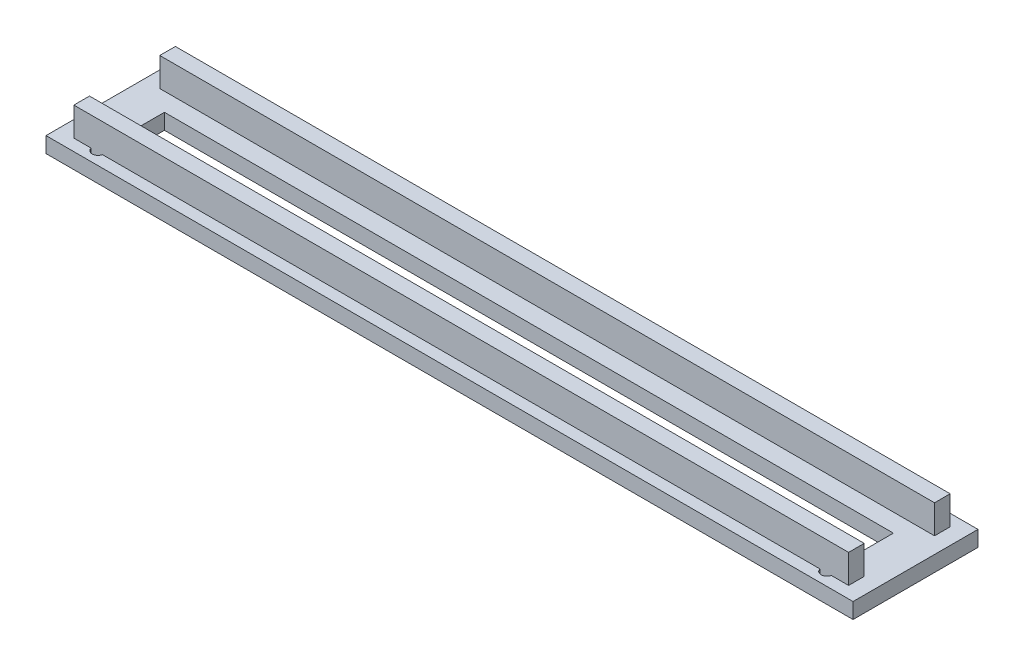
from build123d import *

# Parameters (mm, degrees)
F_01_RAIL_BASE_PROFILE_W   = 620
F_01_RAIL_BASE_PROFILE_H   = 96
F_01_RAIL_BASE_PROFILE_R   = 4.5
F_01_RAIL_BASE_PROFILE_W_2 = 560
F_01_RAIL_BASE_PROFILE_H_2 = 26
F_01_RAIL_BASE_DEPTH       = 12
F_02_GUIDE_RAIL_PROFILES_W = 595.2
F_02_GUIDE_RAIL_PROFILES_H = 12
F_02_GUIDE_RAILS_DEPTH     = 34


with BuildPart() as part:
    # 01_Rail_Base_Profile → 01_Rail_Base (new body)
    with BuildSketch(Plane(origin=(0, 0, 0), x_dir=(1, 0, 0), z_dir=(0, 1, 0))):
        Rectangle(F_01_RAIL_BASE_PROFILE_W, F_01_RAIL_BASE_PROFILE_H)
        with Locations((-280, -38)):
            Circle(F_01_RAIL_BASE_PROFILE_R, mode=Mode.SUBTRACT)
        with Locations((-280, 38)):
            Circle(F_01_RAIL_BASE_PROFILE_R, mode=Mode.SUBTRACT)
        with Locations((280, -38)):
            Circle(F_01_RAIL_BASE_PROFILE_R, mode=Mode.SUBTRACT)
        with Locations((280, 38)):
            Circle(F_01_RAIL_BASE_PROFILE_R, mode=Mode.SUBTRACT)
        Rectangle(F_01_RAIL_BASE_PROFILE_W_2, F_01_RAIL_BASE_PROFILE_H_2, mode=Mode.SUBTRACT)
    extrude(amount=F_01_RAIL_BASE_DEPTH)

    # 02_Guide_Rail_Profiles → 02_Guide_Rails (add)
    with BuildSketch(Plane(origin=(0, 0, 0), x_dir=(1, 0, 0), z_dir=(0, 1, 0))):
        with Locations((0, 33)):
            Rectangle(F_02_GUIDE_RAIL_PROFILES_W, F_02_GUIDE_RAIL_PROFILES_H)
        with Locations((0, -33)):
            Rectangle(F_02_GUIDE_RAIL_PROFILES_W, F_02_GUIDE_RAIL_PROFILES_H)
    extrude(amount=F_02_GUIDE_RAILS_DEPTH)


solid = part.part
